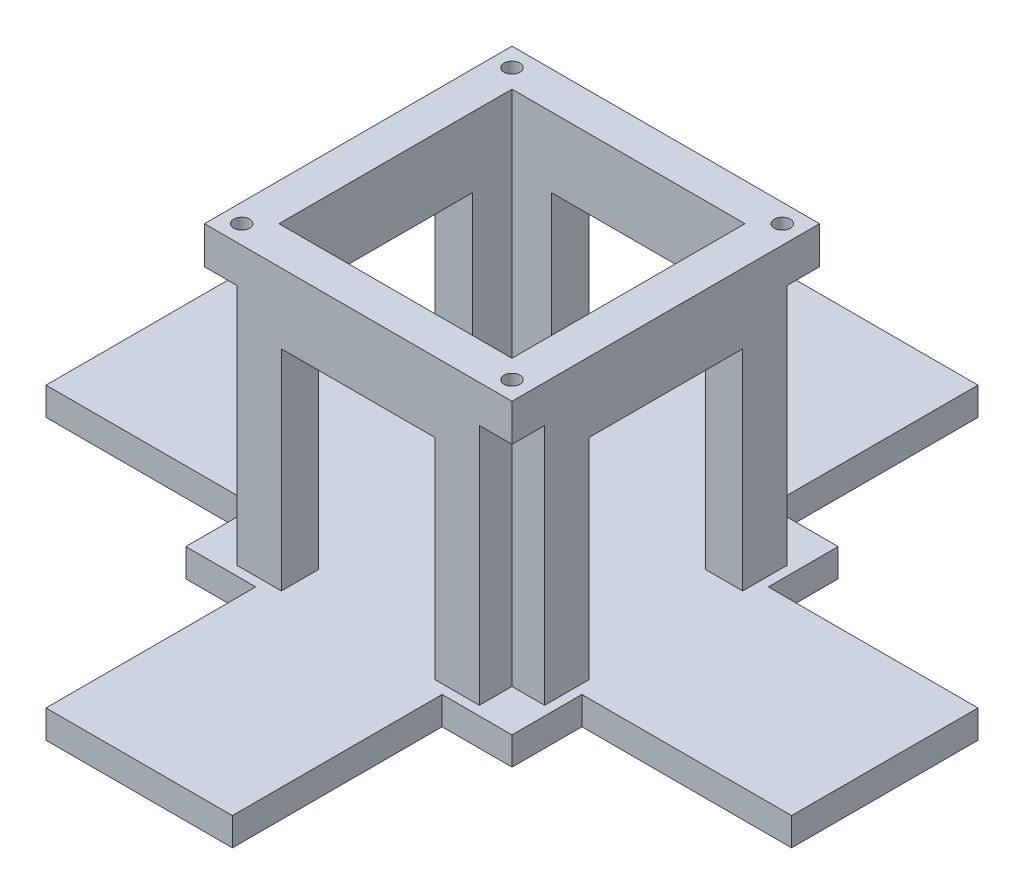
from build123d import *

# Parameters (mm, degrees)
BOSS_EXTRUDE1_DEPTH = 6
SKETCH2_W           = 66
SKETCH2_H           = 66
SKETCH2_R           = 1.705
SKETCH2_W_2         = 50
SKETCH2_H_2         = 50
BOSS_EXTRUDE2_DEPTH = 60
SKETCH4_W           = 7
SKETCH4_H           = 7
CUT_EXTRUDE2_DEPTH  = 52
SKETCH5_W           = 33
SKETCH5_H           = 8
SKETCH5_W_2         = 8
SKETCH5_H_2         = 33
CUT_EXTRUDE3_DEPTH  = 45


with BuildPart() as part:
    # Sketch1 → Boss-Extrude1 (new body)
    with BuildSketch(Plane(origin=(0, 0, 0), x_dir=(1, 0, 0), z_dir=(0, 1, 0))):
        Polygon((-20, 80), (20, 80), (20, 35), (35, 35), (35, 20), (80, 20), (80, -20), (35, -20), (35, -35), (20, -35), (20, -80), (-20, -80), (-20, -35), (-35, -35), (-35, -20), (-80, -20), (-80, 20), (-35, 20), (-35, 35), (-20, 35), align=None)
    extrude(amount=-BOSS_EXTRUDE1_DEPTH)

    # Sketch2 → Boss-Extrude2 (add)
    with BuildSketch(Plane(origin=(0, 0, 0), x_dir=(1, 0, 0), z_dir=(0, 1, 0))):
        Rectangle(SKETCH2_W, SKETCH2_H)
        with Locations((29, 29)):
            Circle(SKETCH2_R, mode=Mode.SUBTRACT)
        with Locations((-29, 29)):
            Circle(SKETCH2_R, mode=Mode.SUBTRACT)
        with Locations((29, -29)):
            Circle(SKETCH2_R, mode=Mode.SUBTRACT)
        with Locations((-29, -29)):
            Circle(SKETCH2_R, mode=Mode.SUBTRACT)
        Rectangle(SKETCH2_W_2, SKETCH2_H_2, mode=Mode.SUBTRACT)
    extrude(amount=BOSS_EXTRUDE2_DEPTH)

    # Sketch4 → Cut-Extrude2 (cut)
    with BuildSketch(Plane(origin=(0, 0, 0), x_dir=(1, 0, 0), z_dir=(0, 1, 0))):
        with Locations((-29.5, 29.5)):
            Rectangle(SKETCH4_W, SKETCH4_H)
        with Locations((29.5, 29.5)):
            Rectangle(SKETCH4_W, SKETCH4_H)
        with Locations((29.5, -29.5)):
            Rectangle(SKETCH4_W, SKETCH4_H)
        with Locations((-29.5, -29.5)):
            Rectangle(SKETCH4_W, SKETCH4_H)
    extrude(amount=CUT_EXTRUDE2_DEPTH, mode=Mode.SUBTRACT)

    # Sketch5 → Cut-Extrude3 (cut)
    with BuildSketch(Plane(origin=(0, 0, 0), x_dir=(1, 0, 0), z_dir=(0, 1, 0))):
        with Locations((0, 29)):
            Rectangle(SKETCH5_W, SKETCH5_H)
        with Locations((0, -29)):
            Rectangle(SKETCH5_W, SKETCH5_H)
        with Locations((29, 0)):
            Rectangle(SKETCH5_W_2, SKETCH5_H_2)
        with Locations((-29, 0)):
            Rectangle(SKETCH5_W_2, SKETCH5_H_2)
    extrude(amount=CUT_EXTRUDE3_DEPTH, mode=Mode.SUBTRACT)


solid = part.part
